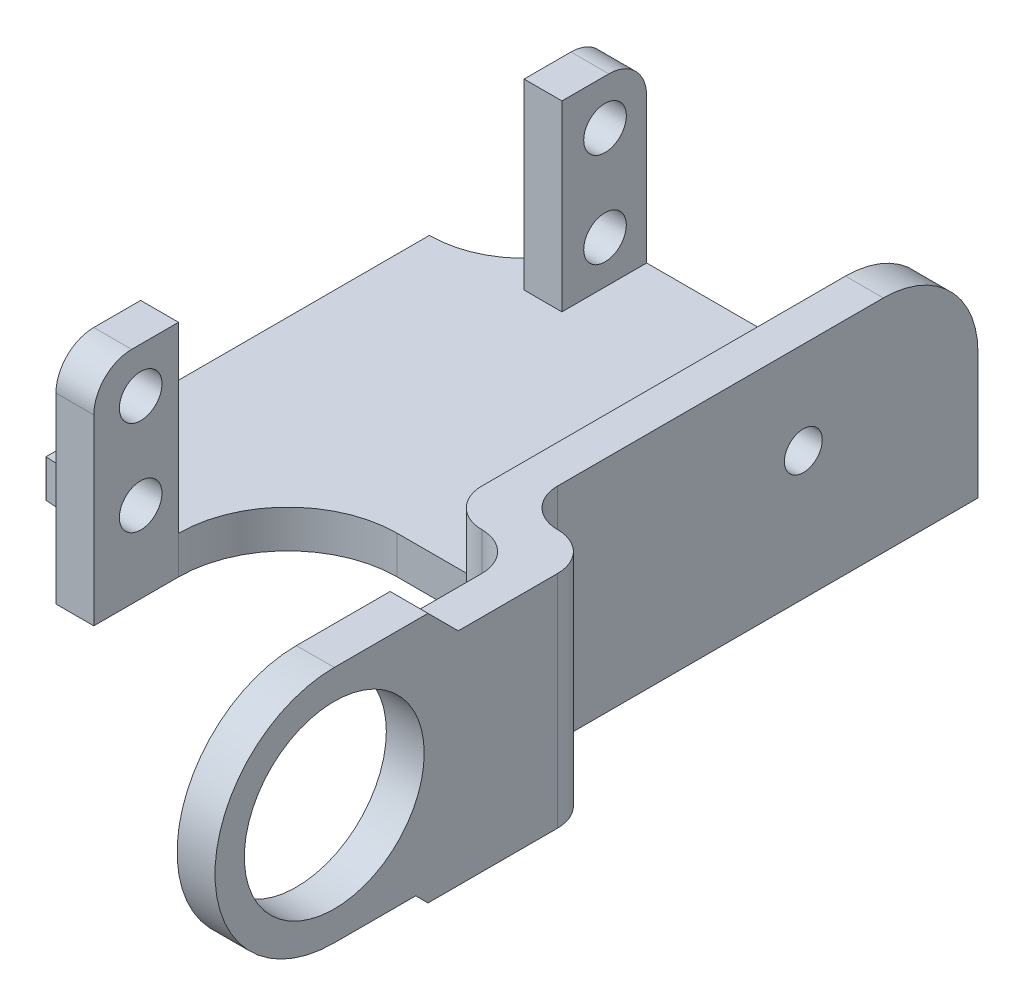
from build123d import *

# Parameters (mm, degrees)
BOSS_EXTRUDE1_DEPTH = 4
SKETCH2_W           = 8.95
SKETCH2_H           = 19.3
SKETCH2_R           = 2.25
BOSS_EXTRUDE2_DEPTH = 4
FILLET1_R           = 10
FILLET2_R           = 4
SKETCH3_W           = 52.4
SKETCH3_H           = 19.3
SKETCH3_R           = 2
BOSS_EXTRUDE3_DEPTH = 4
FILLET3_R           = 10
SKETCH4_W           = 31
SKETCH4_H           = 20.5
CUT_EXTRUDE1_DEPTH  = 10
SKETCH5_W           = 4
SKETCH5_H           = 6
CUT_EXTRUDE2_DEPTH  = 10
FILLET4_R           = 11.55
SKETCH6_W           = 4
SKETCH6_H           = 4
BOSS_EXTRUDE4_DEPTH = 23.3
SKETCH7_R           = 9.5
BOSS_EXTRUDE5_DEPTH = 4
FILLET5_R           = 4


# Some blends are built 0.0001 mm under size
with BuildPart() as part:
    # Sketch1 → Boss-Extrude1 (new body)
    with BuildSketch(Plane(origin=(0, 0, 0), x_dir=(1, 0, 0), z_dir=(0, 1, 0))):
        Polygon((-49, 49.45), (-39, 49.45), (-39, 58.4), (0, 58.4), (0, 0), (-39, 0), (-39, 8.95), (-49, 8.95), align=None)
    extrude(amount=BOSS_EXTRUDE1_DEPTH)

    # Sketch2 → Boss-Extrude2 (add)
    # profile 1 of 2: a face of its own
    with BuildSketch(Plane.ZY.offset(39)):
        with Locations((-4.475, 13.65)):
            Rectangle(SKETCH2_W, SKETCH2_H)
        with Locations((-4.95, 18.55)):
            Circle(SKETCH2_R, mode=Mode.SUBTRACT)
        with Locations((-4.95, 8.55)):
            Circle(SKETCH2_R, mode=Mode.SUBTRACT)
    # profile 2 of 2: a face of its own
    with BuildSketch(Plane.ZY.offset(39)):
        with Locations((-53.925, 13.65)):
            Rectangle(SKETCH2_W, SKETCH2_H)
        with Locations((-54, 18.55)):
            Circle(SKETCH2_R, mode=Mode.SUBTRACT)
        with Locations((-54, 8.55)):
            Circle(SKETCH2_R, mode=Mode.SUBTRACT)
    extrude(amount=-BOSS_EXTRUDE2_DEPTH)

    # Fillet1
    # the kernel refuses this fillet: 10 mm, written as the material it adds along each edge
    with BuildSketch(Plane(origin=(-39, 0, -49.45), x_dir=(-1, 0, 0), z_dir=(0, 1, 0))) as fillet1_piece_1:
        with BuildLine():
            CenterArc((9.944722218, -10), FILLET1_R, 90, 83.97283344)
            Line((0, -8.95), (0, 0))
            Line((0, 0), (9.944722218, 0))
        make_face()
    extrude(amount=4)
    with BuildSketch(Plane(origin=(-39, 0, -8.95), x_dir=(0, 0, 1), z_dir=(0, 1, 0))) as fillet1_piece_2:
        with BuildLine():
            CenterArc((10, -9.944722218), FILLET1_R, 96.02716656, 83.97283344)
            Line((0, -9.944722218), (0, 0))
            Line((0, 0), (8.95, 0))
        make_face()
    extrude(amount=4)

    # Fillet2
    fillet2_edges = [part.edges().sort_by_distance(p)[0] for p in [
        (-37, 23.3, 0),
        (-37, 23.3, -58.4),
    ]]
    fillet(fillet2_edges, radius=FILLET2_R)

    # Sketch3 → Boss-Extrude3 (add)
    with BuildSketch(Plane(origin=(0, 0, 0), x_dir=(0, 0, -1), z_dir=(1, 0, 0))):
        with Locations((32.2, 13.65)):
            Rectangle(SKETCH3_W, SKETCH3_H)
        with Locations((39.95, 13.55)):
            Circle(SKETCH3_R, mode=Mode.SUBTRACT)
    extrude(amount=-BOSS_EXTRUDE3_DEPTH)

    # Fillet3
    fillet3_edges = [part.edges().sort_by_distance(p)[0] for p in [
        (-2, 23.3, -58.4),
    ]]
    fillet(fillet3_edges, radius=FILLET3_R)

    # Sketch4 → Cut-Extrude1 (cut)
    with BuildSketch(Plane(origin=(0, 4, 0), x_dir=(1, 0, 0), z_dir=(0, 1, 0))):
        with Locations((-19.5, 10.25)):
            Rectangle(SKETCH4_W, SKETCH4_H)
    extrude(amount=-CUT_EXTRUDE1_DEPTH, mode=Mode.SUBTRACT)

    # Sketch5 → Cut-Extrude2 (cut)
    with BuildSketch(Plane(origin=(0, 4, 0), x_dir=(1, 0, 0), z_dir=(0, 1, 0))):
        with Locations((-2, 3)):
            Rectangle(SKETCH5_W, SKETCH5_H)
    extrude(amount=-CUT_EXTRUDE2_DEPTH, mode=Mode.SUBTRACT)

    # Fillet4
    fillet4_edges = [part.edges().sort_by_distance(p)[0] for p in [
        (-35, 2, -20.5),
    ]]
    fillet(fillet4_edges, radius=FILLET4_R)

    # Sketch6 → Boss-Extrude4 (add)
    with BuildSketch(Plane(origin=(0, 23.3, 0), x_dir=(1, 0, 0), z_dir=(0, 1, 0))):
        with Locations((2, 8)):
            Rectangle(SKETCH6_W, SKETCH6_H)
    extrude(amount=-BOSS_EXTRUDE4_DEPTH)

    # Sketch7 → Boss-Extrude5 (add)
    with BuildSketch(Plane(origin=(4, 0, 0), x_dir=(0, 0, -1), z_dir=(1, 0, 0))):
        with BuildLine():
            Line((-4.5, 23.3), (10, 23.3))
            Line((10, 23.3), (10, 0))
            Line((10, 0), (-7.7, 0))
            Line((-7.7, 0), (-9, 1.3))
            Line((-9, 1.3), (-17.6, 1.3))
            ThreePointArc((-17.6, 1.3), (-30.2, 13.9), (-17.6, 26.5))
            Line((-17.6, 26.5), (-7.7, 26.5))
            Line((-7.7, 26.5), (-4.5, 23.3))
        make_face()
        with Locations((-17.6, 13.9)):
            Circle(SKETCH7_R, mode=Mode.SUBTRACT)
    extrude(amount=BOSS_EXTRUDE5_DEPTH)

    # Fillet5
    fillet5_edges = [part.edges().sort_by_distance(p)[0] for p in [
        (4, 11.65, -6),
        (0, 11.65, -10),
    ]]
    fillet(fillet5_edges, radius=FILLET5_R)
    fillet5_2_edges = [part.edges().sort_by_distance(p)[0] for p in [
        (-4, 11.65, -6),
        (8, 11.65, -10),
    ]]
    fillet(fillet5_2_edges, radius=FILLET5_R - 0.0001)  # a hair under: the kernel refuses the full size


solid = part.part
